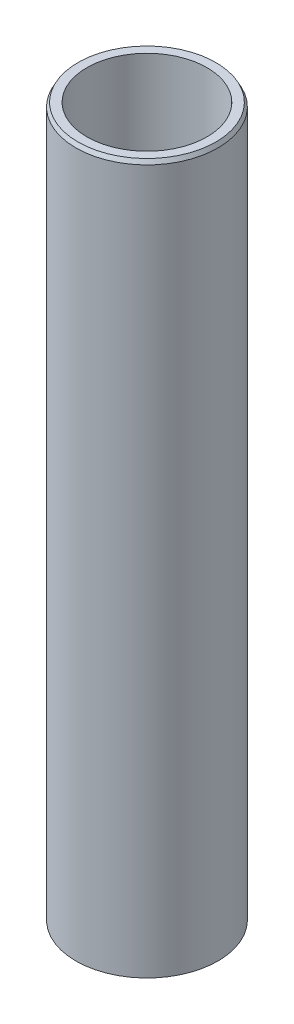
from build123d import *
from OCP.BRepFilletAPI import BRepFilletAPI_MakeChamfer

# Parameters (mm, degrees)
SKETCH1_R           = 60
BOSS_EXTRUDE1_DEPTH = 600
SKETCH2_R           = 50.714653902
CUT_EXTRUDE1_DEPTH  = 606.970296302
CHAMFER1_SIZE       = 3.423456276
CHAMFER1_SIZE2      = 1.800392541


with BuildPart() as part:
    # Sketch1 → Boss-Extrude1 (new body)
    with BuildSketch(Plane(origin=(0, 0, 0), x_dir=(1, 0, 0), z_dir=(0, 1, 0))):
        Circle(SKETCH1_R)
    extrude(amount=BOSS_EXTRUDE1_DEPTH)

    # Sketch2 → Cut-Extrude1 (cut, through all)
    with BuildSketch(Plane(origin=(0, 0, 0), x_dir=(1, 0, 0), z_dir=(0, 1, 0))):
        Circle(SKETCH2_R)
    extrude(amount=CUT_EXTRUDE1_DEPTH, mode=Mode.SUBTRACT)

    # Chamfer1: one chamfer whose edges measure the first distance from different faces: ONE call of the kernel's chamfer builder (chamfer() names one face for all edges)
    chamfer1_edges_1 = [part.edges().sort_by_distance(p)[0] for p in [
        (-60, 600, 0),
    ]]
    chamfer1_side_1 = [part.faces().sort_by_distance(p)[0] for p in [
        (-60, 300, 0),
    ]]
    chamfer1_edges_2 = [part.edges().sort_by_distance(p)[0] for p in [
        (-60, 0, 0),
    ]]
    chamfer1_side_2 = [part.faces().sort_by_distance(p)[0] for p in [
        (-58.302943725, 0, 0),
    ]]
    chamfer1 = BRepFilletAPI_MakeChamfer(part.part.solid().wrapped)
    for e in chamfer1_edges_1:
        chamfer1.Add(CHAMFER1_SIZE, CHAMFER1_SIZE2, e.wrapped, chamfer1_side_1[0].wrapped)  # the first distance lies on this face
    for e in chamfer1_edges_2:
        chamfer1.Add(CHAMFER1_SIZE, CHAMFER1_SIZE2, e.wrapped, chamfer1_side_2[0].wrapped)  # the first distance lies on this face
    add(Compound.cast(chamfer1.Shape()), mode=Mode.REPLACE)


solid = part.part
